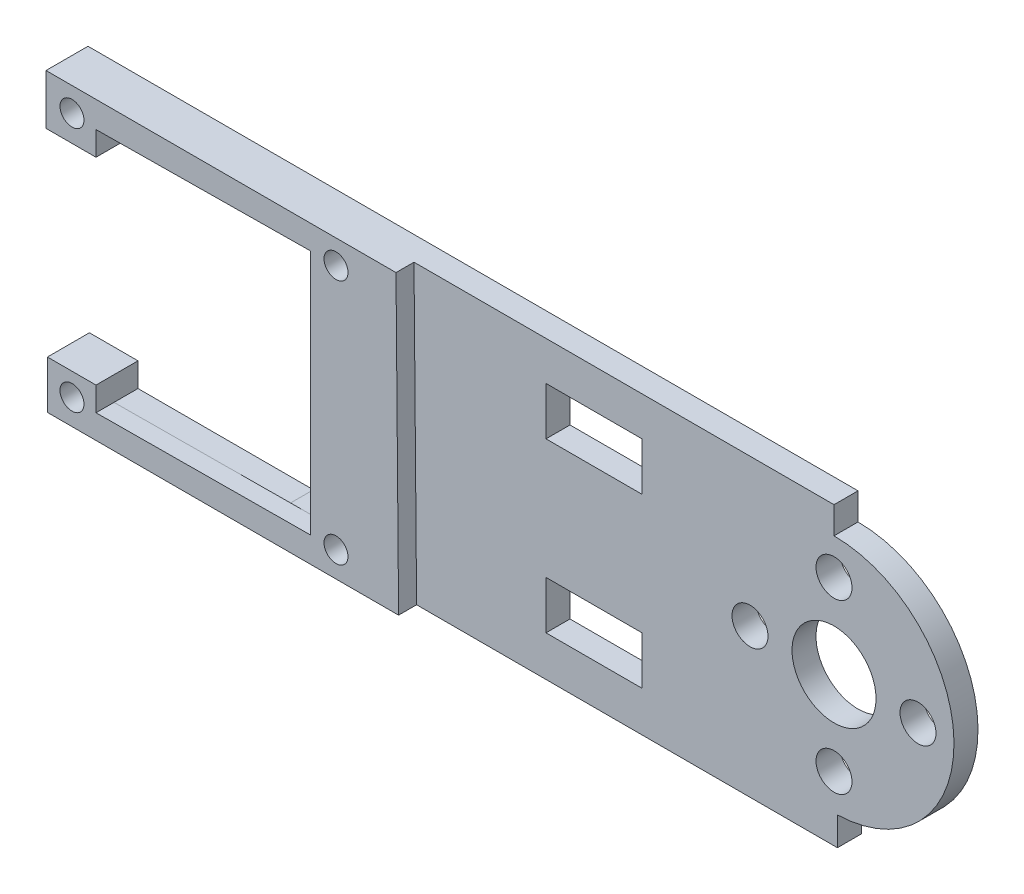
from build123d import *

# Parameters (mm, degrees)
SKETCH1_R           = 1
SKETCH1_R_2         = 1.5
SKETCH1_R_3         = 3.5
SKETCH1_W           = 8
SKETCH1_H           = 4
BOSS_EXTRUDE1_DEPTH = 2
SKETCH5_R           = 1
BOSS_EXTRUDE2_DEPTH = 1.5


with BuildPart() as part:
    # Sketch1 → Boss-Extrude1 (new body)
    with BuildSketch(Plane.XY):
        with BuildLine():
            Line((-5.166471095, 12.25), (5, 12.25))
            Line((5, 12.25), (40, 12.25))
            Line((40, 12.25), (40, 10))
            ThreePointArc((40, 10), (49.998986419, 0.142374811), (40.284720759, -9.995945883))
            Line((40.284720759, -9.995945883), (40.284720759, -12.368142505))
            Line((40.284720759, -12.368142505), (5.21629802, -12.368142505))
            Line((5.21629802, -12.368142505), (-5.048221431, -12.368142505))
            Line((-5.048221431, -12.368142505), (-24.048221431, -12.368142505))
            Line((-24.048221431, -12.368142505), (-24.048221431, -8.368142505))
            Line((-24.048221431, -8.368142505), (-20, -8.368142505))
            Line((-20, -8.368142505), (-20, -10.368142505))
            Line((-20, -10.368142505), (-5.3848969, -10.368142505))
            Line((-5.3848969, -10.368142505), (-2.1348969, -10.25))
            Line((-2.1348969, -10.25), (-2.1348969, 10.25))
            Line((-2.1348969, 10.25), (-5.3848969, 10.25))
            Line((-5.3848969, 10.25), (-20, 10.070848619))
            Line((-20, 10.070848619), (-20, 8.070848619))
            Line((-20, 8.070848619), (-24.166471095, 8.070848619))
            Line((-24.166471095, 8.070848619), (-24.166471095, 12.25))
            Line((-24.166471095, 12.25), (-5.166471095, 12.25))
        make_face()
        with Locations((0, 10.25)):
            Circle(SKETCH1_R, mode=Mode.SUBTRACT)
        with Locations((0, -10.25)):
            Circle(SKETCH1_R, mode=Mode.SUBTRACT)
        with Locations((40, 7)):
            Circle(SKETCH1_R_2, mode=Mode.SUBTRACT)
        with Locations((47, 0)):
            Circle(SKETCH1_R_2, mode=Mode.SUBTRACT)
        with Locations((40, -7)):
            Circle(SKETCH1_R_2, mode=Mode.SUBTRACT)
        with Locations((33, 0)):
            Circle(SKETCH1_R_2, mode=Mode.SUBTRACT)
        with Locations((40, 0)):
            Circle(SKETCH1_R_3, mode=Mode.SUBTRACT)
        with Locations((-22, 10.25)):
            Circle(SKETCH1_R, mode=Mode.SUBTRACT)
        with Locations((-22, -10.25)):
            Circle(SKETCH1_R, mode=Mode.SUBTRACT)
        with Locations((20, 7)):
            Rectangle(SKETCH1_W, SKETCH1_H, mode=Mode.SUBTRACT)
        with Locations((20, -7)):
            Rectangle(SKETCH1_W, SKETCH1_H, mode=Mode.SUBTRACT)
    extrude(amount=BOSS_EXTRUDE1_DEPTH)

    # Sketch5 → Boss-Extrude2 (add)
    with BuildSketch(Plane.XY.offset(2)):
        Polygon((-24.166471095, 12.25), (-24.166471095, 8.070848619), (-20, 8.070848619), (-20, 10.070848619), (-2.1348969, 10.25), (-2.1348969, -10.25), (-20, -10.368142505), (-20, -8.368142505), (-24.048221431, -8.368142505), (-24.048221431, -12.368142505), (5.21629802, -12.368142505), (5, 12.25), align=None)
        with Locations((-22, 10.25)):
            Circle(SKETCH5_R, mode=Mode.SUBTRACT)
        with Locations((-22, -10.25)):
            Circle(SKETCH5_R, mode=Mode.SUBTRACT)
        with Locations((0, -10.25)):
            Circle(SKETCH5_R, mode=Mode.SUBTRACT)
        with Locations((0, 10.25)):
            Circle(SKETCH5_R, mode=Mode.SUBTRACT)
    extrude(amount=BOSS_EXTRUDE2_DEPTH)


solid = part.part
